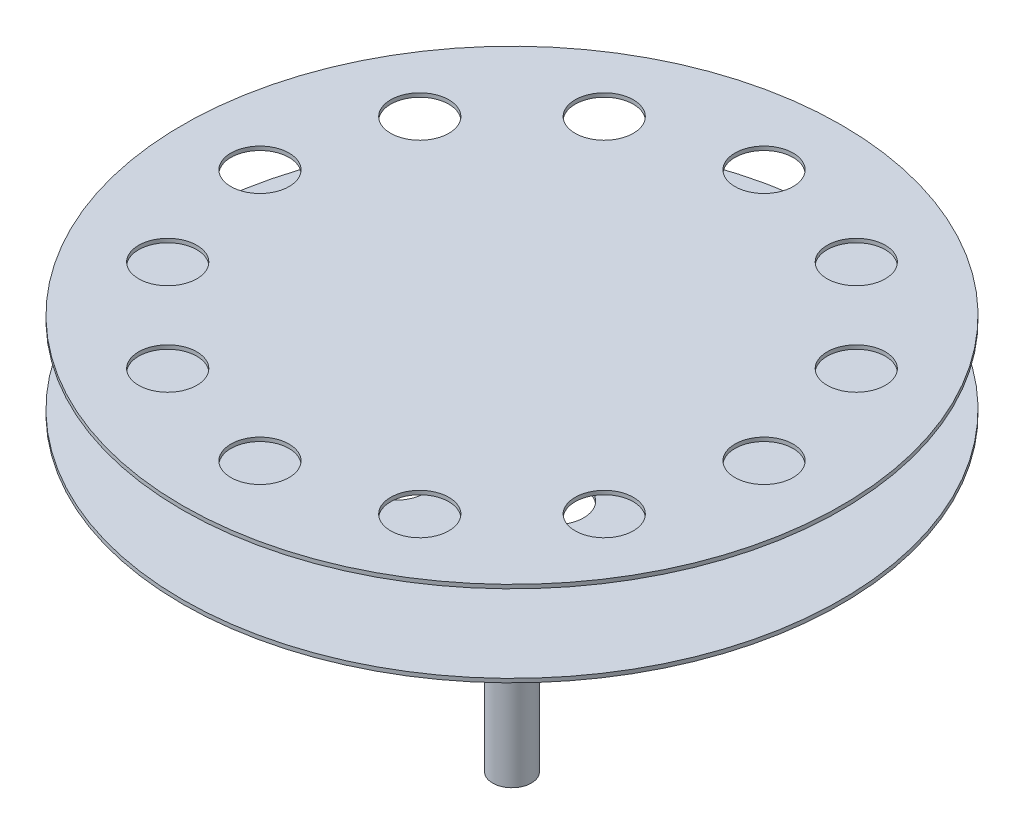
from build123d import *

# Parameters (mm, degrees)
SKETCH2_R          = 7.5
CUT_EXTRUDE1_DEPTH = 2
CIRPATTERN1_COUNT  = 12
SKETCH3_R          = 7.5
CUT_EXTRUDE2_DEPTH = 2
CIRPATTERN2_COUNT  = 6


with BuildPart() as part:
    # Sketch1 → Revolve1 (revolve)
    with BuildSketch(Plane.XY):
        Polygon((0, 102), (-84.99983, 102), (-84.99983, 101), (-5, 101), (-5, 81), (-84.99983, 81), (-84.99983, 80), (-5, 80), (-5, 0), (0, 0), align=None)
    revolve(axis=Axis((0, 54.874193188, 0), (0, -1, 0)))

    # Sketch2 → Cut-Extrude1 (cut)
    with BuildSketch(Plane(origin=(0, 102, 0), x_dir=(1, 0, 0), z_dir=(0, 1, 0))):
        with Locations((0, 65)):
            Circle(SKETCH2_R)
    cut_extrude1 = extrude(amount=-CUT_EXTRUDE1_DEPTH, mode=Mode.SUBTRACT)

    # CirPattern1: Cut-Extrude1 ×12 about axis
    cirpattern1_axis = Axis((0, 54.874193188, 0), (0, -1, 0))
    for i in range(1, CIRPATTERN1_COUNT):
        add(cut_extrude1.rotate(cirpattern1_axis, i * 360 / CIRPATTERN1_COUNT), mode=Mode.SUBTRACT)

    # Sketch3 → Cut-Extrude2 (cut)
    with BuildSketch(Plane.XZ.offset(-80)):
        with Locations((0, 30)):
            Circle(SKETCH3_R)
    cut_extrude2 = extrude(amount=-CUT_EXTRUDE2_DEPTH, mode=Mode.SUBTRACT)

    # CirPattern2: Cut-Extrude2 ×6 about axis
    cirpattern2_axis = Axis((0, 54.874193188, 0), (0, -1, 0))
    for i in range(1, CIRPATTERN2_COUNT):
        add(cut_extrude2.rotate(cirpattern2_axis, i * 360 / CIRPATTERN2_COUNT), mode=Mode.SUBTRACT)


solid = part.part
